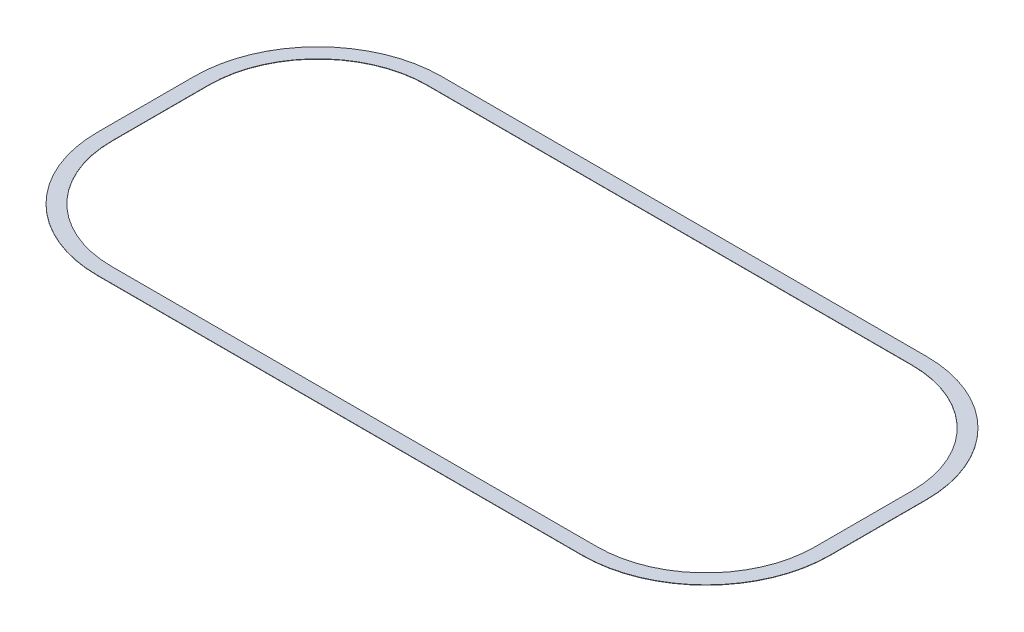
from build123d import *

# Parameters (mm, degrees)
BOSS_EXTRUDE1_DEPTH = 50.8


with BuildPart() as part:
    # Sketch1 → Boss-Extrude1 (new body)
    with BuildSketch(Plane(origin=(0, 0, 0), x_dir=(1, 0, 0), z_dir=(0, 1, 0))):
        with BuildLine():
            Line((0, 0), (83820, 0))
            ThreePointArc((83820, 0), (98912.902724058, 6251.685003883), (105164.58772794, 21344.58772794))
            Line((105164.58772794, 21344.58772794), (105164.58772794, 38108.58772794))
            ThreePointArc((105164.58772794, 38108.58772794), (98912.902724058, 53201.490451998), (83820, 59453.17545588))
            Line((83820, 59453.17545588), (0, 59453.17545588))
            ThreePointArc((0, 59453.17545588), (-15092.902724058, 53201.490451998), (-21344.58772794, 38108.58772794))
            Line((-21344.58772794, 38108.58772794), (-21344.58772794, 21344.58772794))
            ThreePointArc((-21344.58772794, 21344.58772794), (-15092.902724058, 6251.685003883), (0, 0))
        make_face()
        with BuildLine():
            Line((0, 2540), (83820, 2540))
            ThreePointArc((83820, 2540), (97116.851499844, 8047.736228096), (102624.58772794, 21344.58772794))
            Line((102624.58772794, 21344.58772794), (102624.58772794, 38108.58772794))
            ThreePointArc((102624.58772794, 38108.58772794), (97116.851499844, 51405.439227784), (83820, 56913.17545588))
            Line((83820, 56913.17545588), (0, 56913.17545588))
            ThreePointArc((0, 56913.17545588), (-13296.851499844, 51405.439227784), (-18804.58772794, 38108.58772794))
            Line((-18804.58772794, 38108.58772794), (-18804.58772794, 21344.58772794))
            ThreePointArc((-18804.58772794, 21344.58772794), (-13296.851499844, 8047.736228096), (0, 2540))
        make_face(mode=Mode.SUBTRACT)
    extrude(amount=BOSS_EXTRUDE1_DEPTH)


solid = part.part
